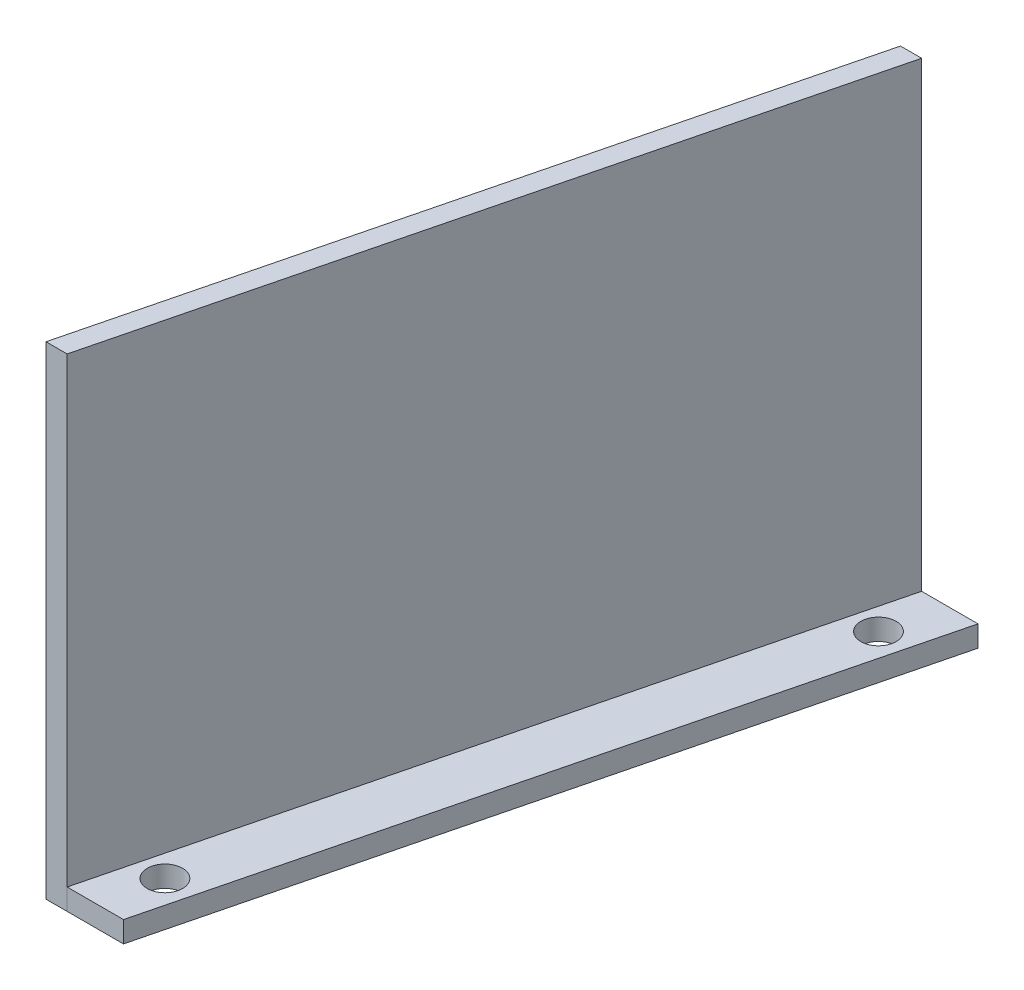
from build123d import *

# Parameters (mm, degrees)
BOSS_EXTRUDE6_START       = -141.338468014
BOSS_EXTRUDE6_DEPTH       = 27.296026611
BOSS_EXTRUDE6_START_2     = -101.470072675
BOSS_EXTRUDE6_2_OUTLINE_W = 72
BOSS_EXTRUDE6_2_OUTLINE_H = 103
BOSS_EXTRUDE6_2_DEPTH     = 23.568848061
BOSS_EXTRUDE6_START_3     = -127.947953139
BOSS_EXTRUDE6_3_OUTLINE_W = 72
BOSS_EXTRUDE6_3_OUTLINE_H = 103
BOSS_EXTRUDE6_3_DEPTH     = 23.567768302
SKETCH1_R                 = 2.5
BOSS_EXTRUDE8_DEPTH       = 3


with BuildPart() as part:
    # Boss-Extrude6: read off the stored shape, not the designer's step
    # Boss-Extrude6 outline → Boss-Extrude6 (new body)
    with BuildSketch(Plane.YZ.offset(BOSS_EXTRUDE6_START)):
        Polygon((86.01064189, 134.693213905), (17.476837079, 134.693213905), (17.476837075, 37.689278418), (86.008364377, 37.690000992), align=None)
    extrude(amount=BOSS_EXTRUDE6_DEPTH)

    # Boss-Extrude6 2 outline → Boss-Extrude6 2 (cut)
    with BuildSketch(Plane(origin=(0, 0, 0), x_dir=(1.5283083166138014e-05, 0.9999999998758877, 3.827802984502311e-06), z_dir=(0.9700373872996308, -1.5755148579155195e-05, 0.24295568936059395)).offset(BOSS_EXTRUDE6_START_2)):
        with Locations((52, 114.5)):
            Rectangle(BOSS_EXTRUDE6_2_OUTLINE_W, BOSS_EXTRUDE6_2_OUTLINE_H)
    extrude(amount=BOSS_EXTRUDE6_2_DEPTH, mode=Mode.SUBTRACT)

    # Boss-Extrude6 3 outline → Boss-Extrude6 3 (cut)
    with BuildSketch(Plane(origin=(0, 0, 0), x_dir=(1.5283083166138014e-05, 0.9999999998758877, 3.827802984502311e-06), z_dir=(0.9700373872996308, -1.5755148579155195e-05, 0.24295568936059395)).offset(BOSS_EXTRUDE6_START_3)):
        with Locations((52, 114.5)):
            Rectangle(BOSS_EXTRUDE6_3_OUTLINE_W, BOSS_EXTRUDE6_3_OUTLINE_H)
    extrude(amount=BOSS_EXTRUDE6_3_DEPTH, mode=Mode.SUBTRACT)

    # Sketch1 → Boss-Extrude8 (add)
    with BuildSketch(Plane.XZ.offset(-17.476837075)):
        Polygon((-138.338991718, 134.693148321), (-130.338991718, 134.693148321), (-106.043946484, 37.689278418), (-114.043946484, 37.689278418), (-117.043946484, 37.689278418), (-141.338991718, 134.693148321), align=None)
        with Locations(Location((-132.458903411, 126.693148321, 0), (0, 0, 270))):
            Circle(SKETCH1_R, mode=Mode.SUBTRACT)
        with Locations(Location((-112.171128445, 45.689278418, 0), (0, 0, 270))):
            Circle(SKETCH1_R, mode=Mode.SUBTRACT)
    extrude(amount=-BOSS_EXTRUDE8_DEPTH)


solid = part.part
